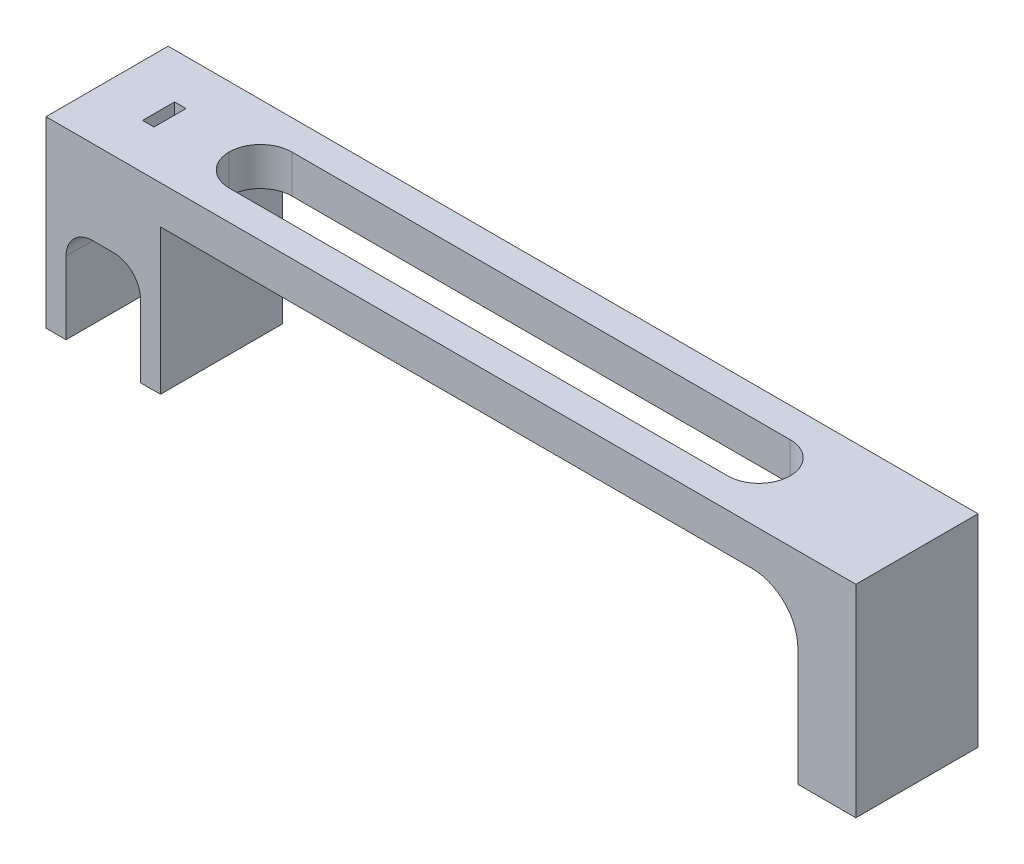
from build123d import *

# Parameters (mm, degrees)
EXTRUDE_1_DEPTH     = 16
SKETCH_4_W          = 1.5
SKETCH_4_H          = 4.2
SKETCH_4_W_2        = 73.5
SKETCH_4_H_2        = 8.2
CUT_EXTRUDE_1_DEPTH = 10
FILLET_1_R          = 4.1
SKETCH_6_W          = 10
SKETCH_6_H          = 16
SKETCH_6_W_2        = 1.5
SKETCH_6_H_2        = 4.2
EXTRUDE_4_DEPTH     = 11
EXTRUDE_START       = -11
SKETCH_10_W         = 0.125
SKETCH_10_H         = 16
SKETCH_10_W_2       = 2.5
EXTRUDE_6_DEPTH     = 24
FILLET_2_R          = 3.5
FILLET_3_R          = 6


with BuildPart() as part:
    # 스케치1 → 보스-돌출1 (new body)
    with BuildSketch(Plane.XY):
        Polygon((-96, 0), (0, 0), (0, -21.5), (7.6, -21.5), (7.6, 5), (-96, 5), align=None)
    extrude(amount=EXTRUDE_1_DEPTH)

    # 스케치4 → 컷-돌출1 (cut)
    with BuildSketch(Plane.XZ):
        with Locations((-91, 8)):
            Rectangle(SKETCH_4_W, SKETCH_4_H)
        with Locations((-45.75, 8)):
            Rectangle(SKETCH_4_W_2, SKETCH_4_H_2)
    extrude(amount=-CUT_EXTRUDE_1_DEPTH, mode=Mode.SUBTRACT)

    # 필렛1
    fillet_1_edges = [part.edges().sort_by_distance(p)[0] for p in [
        (-82.5, 2.5, 3.9),
        (-82.5, 2.5, 12.1),
        (-9, 2.5, 3.9),
        (-9, 2.5, 12.1),
    ]]
    fillet(fillet_1_edges, radius=FILLET_1_R - 0.0001)  # a hair under: the kernel refuses the full size

    # 스케치6 → 보스-돌출4 (add)
    with BuildSketch(Plane(origin=(0, 5, 0), x_dir=(1, 0, 0), z_dir=(0, 1, 0))):
        with Locations((-91, -8)):
            Rectangle(SKETCH_6_W, SKETCH_6_H)
        with Locations((-91, -8)):
            Rectangle(SKETCH_6_W_2, SKETCH_6_H_2, mode=Mode.SUBTRACT)
    extrude(amount=-EXTRUDE_4_DEPTH)

    # 스케치10 → 보스-돌출6 (add)
    with BuildSketch(Plane.XZ.offset(6).offset(EXTRUDE_START)):
        with Locations((-95.9375, 8)):
            Rectangle(SKETCH_10_W, SKETCH_10_H)
        with Locations((-97.25, 8)):
            Rectangle(SKETCH_10_W_2, SKETCH_10_H)
        with Locations((-86.0625, 8)):
            Rectangle(SKETCH_10_W, SKETCH_10_H)
        with Locations((-84.75, 8)):
            Rectangle(SKETCH_10_W_2, SKETCH_10_H)
    extrude(amount=EXTRUDE_6_DEPTH)

    # 필렛2
    fillet_2_edges = [part.edges().sort_by_distance(p)[0] for p in [
        (-95.875, -6, 8),
        (-86.125, -6, 8),
    ]]
    fillet(fillet_2_edges, radius=FILLET_2_R)

    # 필렛3
    fillet_3_edges = [part.edges().sort_by_distance(p)[0] for p in [
        (0, 0, 8),
    ]]
    fillet(fillet_3_edges, radius=FILLET_3_R)


solid = part.part
